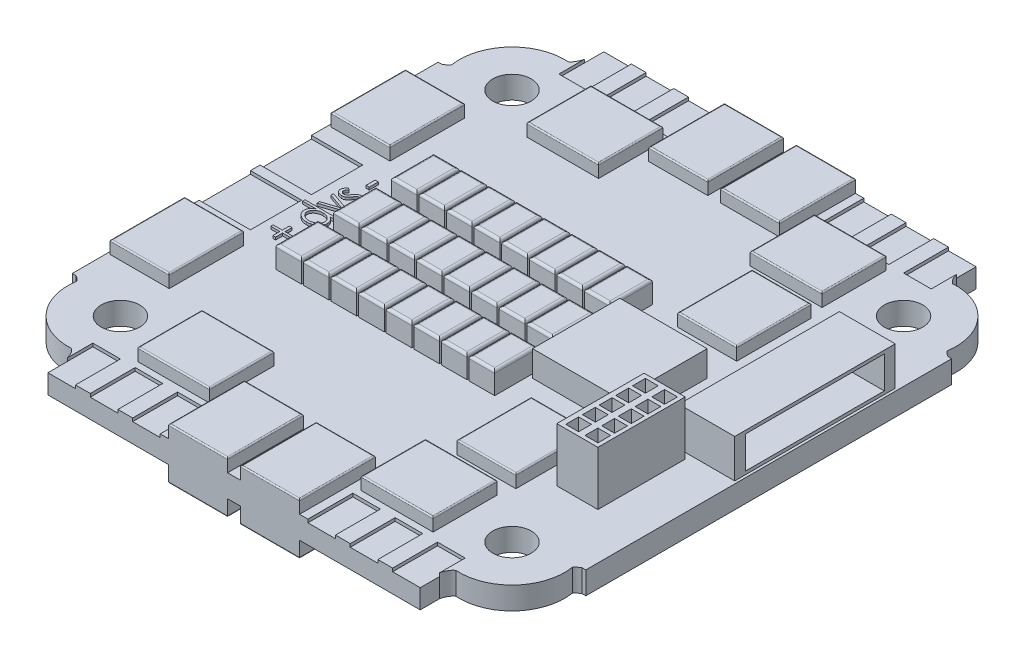
from build123d import *

# Parameters (mm, degrees)
IZIM1_W                          = 40
IZIM1_H                          = 43.3
Y_KSEKLIK_EKSTR_ZYON1_DEPTH      = 1.75
IZIM2_R                          = 1.5
KES_EKSTR_ZYON1_DEPTH            = 1.75
KES_EKSTR_ZYON4_DEPTH            = 1.75
KES_EKSTR_ZYON5_START            = 1.5
IZIM5_W                          = 2.147747616
IZIM5_H                          = 3.5
IZIM5_W_2                        = 2.15
KES_EKSTR_ZYON5_DEPTH            = 1
KES_EKSTR_ZYON7_START            = 1.5
IZIM6_W                          = 4
IZIM6_H                          = 4
KES_EKSTR_ZYON7_DEPTH            = 1
Y_KSEKLIK_EKSTR_ZYON2_DEPTH      = 2.75
Y_KSEKLIK_EKSTR_ZYON2_DEPTH_BACK = 1.25
IZIM7_W                          = 4.6
IZIM7_H                          = 5.8
IZIM9_W                          = 6.8
IZIM9_H                          = 6.8
Y_KSEKLIK_EKSTR_ZYON3_DEPTH      = 3.75
Y_KSEKLIK_EKSTR_ZYON4_DEPTH      = 2.75
Y_KSEKLIK_EKSTR_ZYON4_DEPTH_BACK = 1.25
IZIM10_W                         = 4.597884631
IZIM10_H                         = 5.9
IZIM10_W_2                       = 5.59620667
IZIM10_H_2                       = 5
IZIM11_W                         = 4
IZIM11_H                         = 4
KES_EKSTR_ZYON8_DEPTH            = 0.5
Y_KSEKLIK_EKSTR_ZYON5_START      = 1.75
IZIM12_W                         = 4.35
IZIM12_H                         = 12.5
Y_KSEKLIK_EKSTR_ZYON5_DEPTH      = 3
IZIM13_W                         = 10.8
IZIM13_H                         = 2.5
KES_EKSTR_ZYON9_DEPTH            = 13
Y_KSEKLIK_EKSTR_ZYON6_START      = 1.75
IZIM14_W                         = 3.2
IZIM14_H                         = 6.8
Y_KSEKLIK_EKSTR_ZYON6_DEPTH      = 4.2
IZIM15_W                         = 1
IZIM15_H                         = 1.002257236
KES_EKSTR_ZYON10_DEPTH           = 3
IZIM16_W                         = 2
IZIM16_H                         = 3.3
Y_KSEKLIK_EKSTR_ZYON7_DEPTH      = 3.45
RADYUS1_R                        = 0.2
RADYUS2_R                        = 0.1
IZIM17_W                         = 0.24423077
IZIM17_H                         = 0.702163462
Y_KSEKLIK_EKSTR_ZYON8_DEPTH      = 0.2
L_EK1_SCALE                      = 0.5


with BuildPart() as part:
    # Çizim1 → Yükseklik-Ekstrüzyon1 (new body)
    with BuildSketch(Plane(origin=(0, 0, 0), x_dir=(1, 0, 0), z_dir=(0, 1, 0))):
        Rectangle(IZIM1_W, IZIM1_H)
    extrude(amount=Y_KSEKLIK_EKSTR_ZYON1_DEPTH)

    # Çizim2 → Kes-Ekstrüzyon1 (cut)
    with BuildSketch(Plane(origin=(0, 0, 0), x_dir=(1, 0, 0), z_dir=(0, 1, 0))):
        with Locations(Location((-15.25, 15.25, 0), (0, 0, 270))):
            Circle(IZIM2_R)
        with Locations(Location((15.25, 15.25, 0), (0, 0, 270))):
            Circle(IZIM2_R)
        with Locations(Location((15.25, -15.25, 0), (0, 0, 270))):
            Circle(IZIM2_R)
        with Locations(Location((-15.25, -15.25, 0), (0, 0, 270))):
            Circle(IZIM2_R)
    extrude(amount=KES_EKSTR_ZYON1_DEPTH, mode=Mode.SUBTRACT)

    # Çizim3 → Kes-Ekstrüzyon4 (cut)
    with BuildSketch(Plane(origin=(0, 0, 0), x_dir=(1, 0, 0), z_dir=(0, 1, 0))):
        with BuildLine():
            Line((-19.717750654, 14.25), (-20, 14.25))
            Line((-20, 14.25), (-20, 21.65))
            Line((-20, 21.65), (-14.5, 21.65))
            Line((-14.5, 21.65), (-14.5, 20.13782588))
            add(Edge.make_bspline(
                [(-14.971291716, 19.340516067), (-14.753664146, 19.481272878), (-14.571354318, 19.808969024), (-14.5, 20.13782588)],
                knots=[0, 0, 0, 0, 1, 1, 1, 1], degree=3))
            ThreePointArc((-14.971291716, 19.340516067), (-18.280627176, 18.01139438), (-19.29702263, 14.593031333))
            add(Edge.make_bspline(
                [(-19.29702263, 14.593031333), (-19.433883097, 14.398452939), (-19.717750654, 14.25)],
                knots=[0, 0, 0, 1, 1, 1], degree=2))
        make_face()
        with BuildLine():
            Line((20, 21.65), (14.5, 21.65))
            Line((14.5, 21.65), (14.5, 20.13782588))
            add(Edge.make_bspline(
                [(14.971291716, 19.340516067), (14.753664146, 19.481272878), (14.571354318, 19.808969024), (14.5, 20.13782588)],
                knots=[0, 0, 0, 0, 1, 1, 1, 1], degree=3))
            ThreePointArc((14.971291716, 19.340516067), (18.280627176, 18.01139438), (19.29702263, 14.593031333))
            add(Edge.make_bspline(
                [(19.29702263, 14.593031333), (19.433883097, 14.398452939), (19.717750654, 14.25)],
                knots=[0, 0, 0, 1, 1, 1], degree=2))
            Line((19.717750654, 14.25), (20, 14.25))
            Line((20, 14.25), (20, 21.65))
        make_face()
        with BuildLine():
            Line((19.717750654, -14.25), (20, -14.25))
            Line((20, -14.25), (20, -21.65))
            Line((20, -21.65), (14.5, -21.65))
            Line((14.5, -21.65), (14.5, -20.13782588))
            add(Edge.make_bspline(
                [(14.971291716, -19.340516067), (14.753664146, -19.481272878), (14.571354318, -19.808969024), (14.5, -20.13782588)],
                knots=[0, 0, 0, 0, 1, 1, 1, 1], degree=3))
            ThreePointArc((14.971291716, -19.340516067), (18.280627176, -18.01139438), (19.29702263, -14.593031333))
            add(Edge.make_bspline(
                [(19.29702263, -14.593031333), (19.433883097, -14.398452939), (19.717750654, -14.25)],
                knots=[0, 0, 0, 1, 1, 1], degree=2))
        make_face()
        with BuildLine():
            Line((-20, -21.65), (-14.5, -21.65))
            Line((-14.5, -21.65), (-14.5, -20.13782588))
            add(Edge.make_bspline(
                [(-14.971291716, -19.340516067), (-14.753664146, -19.481272878), (-14.571354318, -19.808969024), (-14.5, -20.13782588)],
                knots=[0, 0, 0, 0, 1, 1, 1, 1], degree=3))
            ThreePointArc((-14.971291716, -19.340516067), (-18.280627176, -18.01139438), (-19.29702263, -14.593031333))
            add(Edge.make_bspline(
                [(-19.29702263, -14.593031333), (-19.433883097, -14.398452939), (-19.717750654, -14.25)],
                knots=[0, 0, 0, 1, 1, 1], degree=2))
            Line((-19.717750654, -14.25), (-20, -14.25))
            Line((-20, -14.25), (-20, -21.65))
        make_face()
    extrude(amount=KES_EKSTR_ZYON4_DEPTH, mode=Mode.SUBTRACT)

    # Çizim5 → Kes-Ekstrüzyon5 (cut)
    with BuildSketch(Plane(origin=(0, 0, 0), x_dir=(1, 0, 0), z_dir=(0, 1, 0)).offset(KES_EKSTR_ZYON5_START)):
        with Locations((-13.426126192, 19.9)):
            Rectangle(IZIM5_W, IZIM5_H)
        with Locations((-6.823873808, 19.9)):
            Rectangle(IZIM5_W, IZIM5_H)
        with Locations((-10.125, 19.9)):
            Rectangle(IZIM5_W_2, IZIM5_H)
        with Locations((10.125, 19.9)):
            Rectangle(IZIM5_W_2, IZIM5_H)
        with Locations((6.823873808, 19.9)):
            Rectangle(IZIM5_W, IZIM5_H)
        with Locations((13.426126192, 19.9)):
            Rectangle(IZIM5_W, IZIM5_H)
        with Locations((13.426126192, -19.9)):
            Rectangle(IZIM5_W, IZIM5_H)
        with Locations((6.823873808, -19.9)):
            Rectangle(IZIM5_W, IZIM5_H)
        with Locations((10.125, -19.9)):
            Rectangle(IZIM5_W_2, IZIM5_H)
        with Locations((-10.125, -19.9)):
            Rectangle(IZIM5_W_2, IZIM5_H)
        with Locations((-6.823873808, -19.9)):
            Rectangle(IZIM5_W, IZIM5_H)
        with Locations((-13.426126192, -19.9)):
            Rectangle(IZIM5_W, IZIM5_H)
    extrude(amount=KES_EKSTR_ZYON5_DEPTH, mode=Mode.SUBTRACT)

    # Çizim6 → Kes-Ekstrüzyon7 (cut)
    with BuildSketch(Plane(origin=(0, 0, 0), x_dir=(1, 0, 0), z_dir=(0, 1, 0)).offset(KES_EKSTR_ZYON7_START)):
        with Locations((-18, -2.375)):
            Rectangle(IZIM6_W, IZIM6_H)
        with Locations((-18, 2.375)):
            Rectangle(IZIM6_W, IZIM6_H)
    extrude(amount=KES_EKSTR_ZYON7_DEPTH, mode=Mode.SUBTRACT)

    # Çizim7 → Yükseklik-Ekstrüzyon2 (add, two sides: drawn at the far end of the back side and taken through both)
    with BuildSketch(Plane(origin=(0, 0, 0), x_dir=(1, 0, 0), z_dir=(0, 1, 0)).offset(-Y_KSEKLIK_EKSTR_ZYON2_DEPTH_BACK)):
        with Locations((-17.5, -8.6)):
            Rectangle(IZIM7_W, IZIM7_H)
        with Locations((-17.5, 8.6)):
            Rectangle(IZIM7_W, IZIM7_H)
        with Locations((9.5, -8.6)):
            Rectangle(IZIM7_W, IZIM7_H)
        with Locations((9.5, 8.6)):
            Rectangle(IZIM7_W, IZIM7_H)
    extrude(amount=Y_KSEKLIK_EKSTR_ZYON2_DEPTH + Y_KSEKLIK_EKSTR_ZYON2_DEPTH_BACK)

    # Çizim9 → Yükseklik-Ekstrüzyon3 (add)
    with BuildSketch(Plane(origin=(0, 0, 0), x_dir=(1, 0, 0), z_dir=(0, 1, 0))):
        with Locations((8.4, 0)):
            Rectangle(IZIM9_W, IZIM9_H)
    extrude(amount=Y_KSEKLIK_EKSTR_ZYON3_DEPTH)

    # Çizim10 → Yükseklik-Ekstrüzyon4 (add, two sides: drawn at the far end of the back side and taken through both)
    with BuildSketch(Plane(origin=(0, 0, 0), x_dir=(1, 0, 0), z_dir=(0, 1, 0)).offset(-Y_KSEKLIK_EKSTR_ZYON4_DEPTH_BACK)):
        with Locations((-2.801057685, 18.7)):
            Rectangle(IZIM10_W, IZIM10_H)
        with Locations((2.801057685, 18.7)):
            Rectangle(IZIM10_W, IZIM10_H)
        with Locations((8.701896665, 15.15)):
            Rectangle(IZIM10_W_2, IZIM10_H_2)
        with Locations((-8.701896665, 15.15)):
            Rectangle(IZIM10_W_2, IZIM10_H_2)
        with Locations((8.701896665, -15.15)):
            Rectangle(IZIM10_W_2, IZIM10_H_2)
        with Locations((-8.701896665, -15.15)):
            Rectangle(IZIM10_W_2, IZIM10_H_2)
        with Locations((-2.801057685, -18.7)):
            Rectangle(IZIM10_W, IZIM10_H)
        with Locations((2.801057685, -18.7)):
            Rectangle(IZIM10_W, IZIM10_H)
    extrude(amount=Y_KSEKLIK_EKSTR_ZYON4_DEPTH + Y_KSEKLIK_EKSTR_ZYON4_DEPTH_BACK)

    # Çizim11 → Kes-Ekstrüzyon8 (cut)
    with BuildSketch(Plane(origin=(0, 0, 0), x_dir=(1, 0, 0), z_dir=(0, 1, 0))):
        with Locations((-18.003680678, -2.654708619)):
            Rectangle(IZIM11_W, IZIM11_H)
        with Locations((-18.003680678, 2.095291381)):
            Rectangle(IZIM11_W, IZIM11_H)
    extrude(amount=KES_EKSTR_ZYON8_DEPTH, mode=Mode.SUBTRACT)

    # Çizim12 → Yükseklik-Ekstrüzyon5 (add)
    with BuildSketch(Plane(origin=(0, 0, 0), x_dir=(1, 0, 0), z_dir=(0, 1, 0)).offset(Y_KSEKLIK_EKSTR_ZYON5_START)):
        with Locations((17.625, 3.8)):
            Rectangle(IZIM12_W, IZIM12_H)
    extrude(amount=Y_KSEKLIK_EKSTR_ZYON5_DEPTH)

    # Çizim13 → Kes-Ekstrüzyon9 (cut)
    with BuildSketch(Plane(origin=(29.8, 0, 0), x_dir=(0, 0, -1), z_dir=(1, 0, 0))):
        with Locations((3.8, 3.25)):
            Rectangle(IZIM13_W, IZIM13_H)
    extrude(amount=-KES_EKSTR_ZYON9_DEPTH, mode=Mode.SUBTRACT)

    # Çizim14 → Yükseklik-Ekstrüzyon6 (add)
    with BuildSketch(Plane(origin=(0, 0, 0), x_dir=(1, 0, 0), z_dir=(0, 1, 0)).offset(Y_KSEKLIK_EKSTR_ZYON6_START)):
        with Locations((14.8, -6.310712731)):
            Rectangle(IZIM14_W, IZIM14_H)
    extrude(amount=Y_KSEKLIK_EKSTR_ZYON6_DEPTH)

    # Çizim15 → Kes-Ekstrüzyon10 (cut)
    with BuildSketch(Plane(origin=(0, 5.95, 0), x_dir=(1, 0, 0), z_dir=(0, 1, 0))):
        with Locations((14.1, -3.711841349)):
            Rectangle(IZIM15_W, IZIM15_H)
        with Locations((15.6, -3.711841349)):
            Rectangle(IZIM15_W, IZIM15_H)
        with Locations((14.1, -5.011841349)):
            Rectangle(IZIM15_W, IZIM15_H)
        with Locations((14.1, -6.311841349)):
            Rectangle(IZIM15_W, IZIM15_H)
        with Locations((14.1, -7.611841349)):
            Rectangle(IZIM15_W, IZIM15_H)
        with Locations((14.1, -8.911841349)):
            Rectangle(IZIM15_W, IZIM15_H)
        with Locations((15.6, -5.011841349)):
            Rectangle(IZIM15_W, IZIM15_H)
        with Locations((15.6, -6.311841349)):
            Rectangle(IZIM15_W, IZIM15_H)
        with Locations((15.6, -7.611841349)):
            Rectangle(IZIM15_W, IZIM15_H)
        with Locations((15.6, -8.911841349)):
            Rectangle(IZIM15_W, IZIM15_H)
    extrude(amount=-KES_EKSTR_ZYON10_DEPTH, mode=Mode.SUBTRACT)

    # Çizim16 → Yükseklik-Ekstrüzyon7 (add)
    with BuildSketch(Plane(origin=(0, 0, 0), x_dir=(1, 0, 0), z_dir=(0, 1, 0))):
        with Locations((1.55, 4.6)):
            Rectangle(IZIM16_W, IZIM16_H)
        with Locations((3.7, 4.6)):
            Rectangle(IZIM16_W, IZIM16_H)
        with Locations((-0.6, 4.6)):
            Rectangle(IZIM16_W, IZIM16_H)
        with Locations((-2.75, 4.6)):
            Rectangle(IZIM16_W, IZIM16_H)
        with Locations((-4.9, 4.6)):
            Rectangle(IZIM16_W, IZIM16_H)
        with Locations((-7.05, 4.6)):
            Rectangle(IZIM16_W, IZIM16_H)
        with Locations((-9.2, 4.6)):
            Rectangle(IZIM16_W, IZIM16_H)
        with Locations((-11.35, 4.6)):
            Rectangle(IZIM16_W, IZIM16_H)
        with Locations((1.55, 0.1)):
            Rectangle(IZIM16_W, IZIM16_H)
        with Locations((-0.6, 0.1)):
            Rectangle(IZIM16_W, IZIM16_H)
        with Locations((-2.75, 0.1)):
            Rectangle(IZIM16_W, IZIM16_H)
        with Locations((-4.9, 0.1)):
            Rectangle(IZIM16_W, IZIM16_H)
        with Locations((-7.05, 0.1)):
            Rectangle(IZIM16_W, IZIM16_H)
        with Locations((-9.2, 0.1)):
            Rectangle(IZIM16_W, IZIM16_H)
        with Locations((-11.35, 0.1)):
            Rectangle(IZIM16_W, IZIM16_H)
        with Locations((1.55, -4.4)):
            Rectangle(IZIM16_W, IZIM16_H)
        with Locations((-0.6, -4.4)):
            Rectangle(IZIM16_W, IZIM16_H)
        with Locations((-2.75, -4.4)):
            Rectangle(IZIM16_W, IZIM16_H)
        with Locations((-4.9, -4.4)):
            Rectangle(IZIM16_W, IZIM16_H)
        with Locations((-7.05, -4.4)):
            Rectangle(IZIM16_W, IZIM16_H)
        with Locations((-9.2, -4.4)):
            Rectangle(IZIM16_W, IZIM16_H)
        with Locations((-11.35, -4.4)):
            Rectangle(IZIM16_W, IZIM16_H)
        with Locations((3.7, 0.1)):
            Rectangle(IZIM16_W, IZIM16_H)
        with Locations((3.7, -4.4)):
            Rectangle(IZIM16_W, IZIM16_H)
    extrude(amount=Y_KSEKLIK_EKSTR_ZYON7_DEPTH)

    # Radyus1
    radyus1_edges = [part.edges().sort_by_distance(p)[0] for p in [
        (0.4, 3.45, -0.1),
        (-0.6, 3.45, -1.75),
        (-1.6, 3.45, -0.1),
        (-0.6, 3.45, 1.55),
        (-1.75, 3.45, -0.1),
        (-2.75, 3.45, -1.75),
        (-3.75, 3.45, -0.1),
        (-2.75, 3.45, 1.55),
        (-3.9, 3.45, -0.1),
        (-4.9, 3.45, -1.75),
        (-5.9, 3.45, -0.1),
        (-4.9, 3.45, 1.55),
        (-6.05, 3.45, -0.1),
        (-7.05, 3.45, -1.75),
        (-8.05, 3.45, -0.1),
        (-7.05, 3.45, 1.55),
        (-8.2, 3.45, -0.1),
        (-9.2, 3.45, -1.75),
        (-10.2, 3.45, -0.1),
        (-9.2, 3.45, 1.55),
        (-10.35, 3.45, -0.1),
        (-11.35, 3.45, -1.75),
        (-12.35, 3.45, -0.1),
        (-11.35, 3.45, 1.55),
        (2.55, 3.45, 4.4),
        (1.55, 3.45, 2.75),
        (0.55, 3.45, 4.4),
        (1.55, 3.45, 6.05),
        (0.4, 3.45, 4.4),
        (-0.6, 3.45, 2.75),
        (-1.6, 3.45, 4.4),
        (-0.6, 3.45, 6.05),
        (-1.75, 3.45, 4.4),
        (-2.75, 3.45, 2.75),
        (-3.75, 3.45, 4.4),
        (-2.75, 3.45, 6.05),
        (-3.9, 3.45, 4.4),
        (-4.9, 3.45, 2.75),
        (-5.9, 3.45, 4.4),
        (-4.9, 3.45, 6.05),
        (-6.05, 3.45, 4.4),
        (-7.05, 3.45, 2.75),
        (-8.05, 3.45, 4.4),
        (-7.05, 3.45, 6.05),
        (-8.2, 3.45, 4.4),
        (-9.2, 3.45, 2.75),
        (-10.2, 3.45, 4.4),
        (-9.2, 3.45, 6.05),
        (-10.35, 3.45, 4.4),
        (-11.35, 3.45, 2.75),
        (-12.35, 3.45, 4.4),
        (-11.35, 3.45, 6.05),
        (4.7, 3.45, -0.1),
        (3.7, 3.45, -1.75),
        (2.7, 3.45, -0.1),
        (3.7, 3.45, 1.55),
        (4.7, 3.45, 4.4),
        (3.7, 3.45, 2.75),
        (2.7, 3.45, 4.4),
        (3.7, 3.45, 6.05),
        (4.7, 3.45, -4.6),
        (3.7, 3.45, -6.25),
        (2.7, 3.45, -4.6),
        (3.7, 3.45, -2.95),
        (2.55, 3.45, -4.6),
        (1.55, 3.45, -6.25),
        (0.55, 3.45, -4.6),
        (1.55, 3.45, -2.95),
        (0.4, 3.45, -4.6),
        (-0.6, 3.45, -6.25),
        (-1.6, 3.45, -4.6),
        (-0.6, 3.45, -2.95),
        (-1.75, 3.45, -4.6),
        (-2.75, 3.45, -6.25),
        (-3.75, 3.45, -4.6),
        (-2.75, 3.45, -2.95),
        (-3.9, 3.45, -4.6),
        (-4.9, 3.45, -6.25),
        (-5.9, 3.45, -4.6),
        (-4.9, 3.45, -2.95),
        (-6.05, 3.45, -4.6),
        (-7.05, 3.45, -6.25),
        (-8.05, 3.45, -4.6),
        (-7.05, 3.45, -2.95),
        (-8.2, 3.45, -4.6),
        (-9.2, 3.45, -6.25),
        (-10.2, 3.45, -4.6),
        (-9.2, 3.45, -2.95),
        (-10.35, 3.45, -4.6),
        (-11.35, 3.45, -6.25),
        (-12.35, 3.45, -4.6),
        (-11.35, 3.45, -2.95),
        (2.55, 3.45, -0.1),
        (1.55, 3.45, -1.75),
        (0.55, 3.45, -0.1),
        (1.55, 3.45, 1.55),
    ]]
    fillet(radyus1_edges, radius=RADYUS1_R)

    # Radyus2
    radyus2_edges = [part.edges().sort_by_distance(p)[0] for p in [
        (-15.2, -1.25, 8.6),
        (-17.5, -1.25, 11.5),
        (-19.8, -1.25, 8.6),
        (-17.5, -1.25, 5.7),
        (-15.2, 2.75, 8.6),
        (-17.5, 2.75, 5.7),
        (-19.8, 2.75, 8.6),
        (-17.5, 2.75, 11.5),
        (-15.2, -1.25, -8.6),
        (-17.5, -1.25, -5.7),
        (-19.8, -1.25, -8.6),
        (-17.5, -1.25, -11.5),
        (-15.2, 2.75, -8.6),
        (-17.5, 2.75, -11.5),
        (-19.8, 2.75, -8.6),
        (-17.5, 2.75, -5.7),
        (9.5, -1.25, 11.5),
        (7.2, -1.25, 8.6),
        (9.5, -1.25, 5.7),
        (11.8, -1.25, 8.6),
        (9.5, 2.75, 11.5),
        (11.8, 2.75, 8.6),
        (9.5, 2.75, 5.7),
        (7.2, 2.75, 8.6),
        (9.5, -1.25, -11.5),
        (11.8, -1.25, -8.6),
        (9.5, -1.25, -5.7),
        (7.2, -1.25, -8.6),
        (9.5, 2.75, -11.5),
        (7.2, 2.75, -8.6),
        (9.5, 2.75, -5.7),
        (11.8, 2.75, -8.6),
        (-5.1, 2.75, -18.7),
        (-2.801057684, 2.75, -15.75),
        (-0.502115369, 2.75, -18.7),
        (-2.801057684, 2.75, -21.65),
        (2.801057684, 2.75, -15.75),
        (5.1, 2.75, -18.7),
        (2.801057684, 2.75, -21.65),
        (0.502115369, 2.75, -18.7),
        (-11.5, -1.25, -15.15),
        (-8.701896665, -1.25, -17.65),
        (-5.90379333, -1.25, -15.15),
        (-8.701896665, -1.25, -12.65),
        (-11.5, 2.75, -15.15),
        (-8.701896665, 2.75, -12.65),
        (-5.90379333, 2.75, -15.15),
        (-8.701896665, 2.75, -17.65),
        (8.701896665, -1.25, -12.65),
        (5.90379333, -1.25, -15.15),
        (8.701896665, -1.25, -17.65),
        (11.5, -1.25, -15.15),
        (8.701896665, 2.75, -12.65),
        (11.5, 2.75, -15.15),
        (8.701896665, 2.75, -17.65),
        (5.90379333, 2.75, -15.15),
        (11.5, -1.25, 15.15),
        (8.701896665, -1.25, 17.65),
        (5.90379333, -1.25, 15.15),
        (8.701896665, -1.25, 12.65),
        (11.5, 2.75, 15.15),
        (8.701896665, 2.75, 12.65),
        (5.90379333, 2.75, 15.15),
        (8.701896665, 2.75, 17.65),
        (-11.5, -1.25, 15.15),
        (-8.701896665, -1.25, 12.65),
        (-5.90379333, -1.25, 15.15),
        (-8.701896665, -1.25, 17.65),
        (-11.5, 2.75, 15.15),
        (-8.701896665, 2.75, 17.65),
        (-5.90379333, 2.75, 15.15),
        (-8.701896665, 2.75, 12.65),
        (2.801057684, -1.25, 21.65),
        (0.502115369, -1.25, 18.7),
        (2.801057684, -1.25, 15.75),
        (5.1, -1.25, 18.7),
        (2.801057684, 2.75, 21.65),
        (5.1, 2.75, 18.7),
        (2.801057684, 2.75, 15.75),
        (0.502115369, 2.75, 18.7),
        (-2.801057684, -1.25, 15.75),
        (-0.502115369, -1.25, 18.7),
        (-2.801057684, -1.25, 21.65),
        (-5.1, -1.25, 18.7),
        (-2.801057684, 2.75, 15.75),
        (-5.1, 2.75, 18.7),
        (-2.801057684, 2.75, 21.65),
        (-0.502115369, 2.75, 18.7),
    ]]
    fillet(radyus2_edges, radius=RADYUS2_R)

    # Çizim17 → Yükseklik-Ekstrüzyon8 (add)
    # profile 1 of 5: a face of its own
    with BuildSketch(Plane(origin=(0, 1.75, 0), x_dir=(1, 0, 0), z_dir=(0, 1, 0))):
        Polygon((-14.545757748, -3.534220415), (-15.247921209, -3.534220415), (-15.247921209, -3.351047338), (-14.545757748, -3.351047338), (-14.545757748, -2.801528107), (-14.332055825, -2.801528107), (-14.332055825, -3.351047338), (-13.629892363, -3.351047338), (-13.629892363, -3.534220415), (-14.332055825, -3.534220415), (-14.332055825, -4.083739645), (-14.545757748, -4.083739645), align=None)
    # profile 2 of 5: a face of its own
    with BuildSketch(Plane(origin=(0, 1.75, 0), x_dir=(1, 0, 0), z_dir=(0, 1, 0))):
        with BuildLine():
            Line((-15.705853902, -0.420278107), (-13.263546209, -0.420278107))
            Line((-13.263546209, -0.420278107), (-13.263546209, -0.603451184))
            Line((-13.263546209, -0.603451184), (-13.564541552, -0.603451184))
            add(Edge.make_bspline(
                [(-13.564541552, -0.603451184), (-13.53746896, -0.622039409), (-13.485206737, -0.657923005), (-13.415276505, -0.717920722), (-13.357973194, -0.782577607), (-13.311447669, -0.850219237), (-13.276384877, -0.92156596), (-13.251512393, -0.995845728), (-13.235399772, -1.073252432), (-13.233818078, -1.126177633), (-13.233017363, -1.152970415)],
                knots=[0, 0, 0, 0, 1.172747878, 2.263928442, 3.281922024, 4.25087268, 5.188273431, 6.111575823, 7.044006704, 8, 8, 8, 8], degree=3))
            add(Edge.make_bspline(
                [(-13.233017363, -1.152970415), (-13.233851804, -1.176876084), (-13.235498799, -1.224060412), (-13.248319133, -1.293283332), (-13.268974441, -1.359738997), (-13.297844754, -1.423728702), (-13.335207201, -1.484904231), (-13.381215798, -1.542968139), (-13.435037905, -1.598587724), (-13.496490458, -1.650815016), (-13.563766709, -1.698552984), (-13.635064437, -1.740903658), (-13.710308742, -1.776321186), (-13.789292543, -1.804823982), (-13.871611769, -1.827271661), (-13.957388291, -1.843571182), (-14.046742426, -1.853149529), (-14.107518572, -1.854465472), (-14.138388457, -1.855133876)],
                knots=[0, 0, 0, 0, 0.903163779, 1.78263887, 2.651389892, 3.528335299, 4.429236434, 5.353843816, 6.32297284, 7.350379706, 8.397704944, 9.43776181, 10.480939894, 11.536168289, 12.607837322, 13.702913536, 14.833246301, 16, 16, 16, 16], degree=3))
            add(Edge.make_bspline(
                [(-14.138388457, -1.855133876), (-14.16862298, -1.854462767), (-14.228289742, -1.853138356), (-14.316052745, -1.84355125), (-14.400622454, -1.827316159), (-14.481653373, -1.804398577), (-14.559507991, -1.775318543), (-14.633660184, -1.739115665), (-14.705001104, -1.697348132), (-14.771711501, -1.648855802), (-14.83273915, -1.596068044), (-14.886497813, -1.540095364), (-14.932478433, -1.481777235), (-14.969345382, -1.420032406), (-14.998831008, -1.356038427), (-15.019511317, -1.289019636), (-15.0315588, -1.219392803), (-15.033326256, -1.172097059), (-15.034219286, -1.148200282)],
                knots=[0, 0, 0, 0, 1.147764703, 2.265073058, 3.347188514, 4.413563271, 5.458552615, 6.498034846, 7.542675396, 8.593229709, 9.624528646, 10.602280619, 11.535718512, 12.43746343, 13.326263971, 14.204609005, 15.092855845, 16, 16, 16, 16], degree=3))
            add(Edge.make_bspline(
                [(-15.034219286, -1.148200282), (-15.03315849, -1.120757521), (-15.031064667, -1.066590363), (-15.01317639, -0.987458727), (-14.984448014, -0.912314174), (-14.94366916, -0.841261231), (-14.891068499, -0.774827569), (-14.827191093, -0.712360964), (-14.752192023, -0.653963462), (-14.695944499, -0.62064467), (-14.666919106, -0.603451184)],
                knots=[0, 0, 0, 0, 0.951594992, 1.878280231, 2.800748451, 3.735175227, 4.710076232, 5.732587844, 6.829948001, 8, 8, 8, 8], degree=3))
            Line((-14.666919106, -0.603451184), (-15.705853902, -0.603451184))
            Line((-15.705853902, -0.603451184), (-15.705853902, -0.420278107))
        make_face()
        with BuildLine():
            add(Edge.make_bspline(
                [(-14.820517363, -1.137228978), (-14.819420258, -1.161023437), (-14.817249774, -1.208097783), (-14.799623284, -1.277242554), (-14.771320096, -1.34337394), (-14.73178181, -1.406213771), (-14.682054964, -1.464079491), (-14.623355784, -1.516871119), (-14.554690888, -1.561812428), (-14.479109207, -1.601284999), (-14.397338434, -1.632292486), (-14.312417071, -1.655431692), (-14.224844805, -1.669018012), (-14.165782893, -1.670974382), (-14.136003391, -1.671960799)],
                knots=[0, 0, 0, 0, 0.890056594, 1.76086514, 2.654499465, 3.574716069, 4.529255787, 5.503372661, 6.520644566, 7.593881512, 8.690822744, 9.788539383, 10.884963373, 12, 12, 12, 12], degree=3))
            add(Edge.make_bspline(
                [(-14.136003391, -1.671960799), (-14.106383807, -1.670964688), (-14.047482925, -1.668983843), (-13.960213701, -1.655487686), (-13.875117445, -1.632168295), (-13.793038322, -1.600687807), (-13.71623337, -1.561431133), (-13.646783803, -1.515881745), (-13.587240459, -1.462844067), (-13.536835274, -1.404592593), (-13.496604567, -1.342036865), (-13.468158298, -1.27609803), (-13.449932596, -1.208009264), (-13.447792757, -1.161509865), (-13.446719286, -1.138183005)],
                knots=[0, 0, 0, 0, 1.107208297, 2.201771173, 3.291886461, 4.400195165, 5.482177094, 6.510909783, 7.496205014, 8.452991324, 9.383017846, 10.264216512, 11.12922794, 12, 12, 12, 12], degree=3))
            add(Edge.make_bspline(
                [(-13.446719286, -1.138183005), (-13.447857026, -1.114713854), (-13.450130437, -1.067818208), (-13.467574577, -0.998420579), (-13.496607555, -0.931354073), (-13.536409411, -0.867162241), (-13.58521454, -0.807222349), (-13.642903693, -0.753971717), (-13.708719341, -0.708130713), (-13.782127021, -0.670339639), (-13.861868661, -0.640329223), (-13.946837461, -0.618978492), (-14.03668716, -0.605750756), (-14.098272569, -0.604229841), (-14.129802219, -0.603451184)],
                knots=[0, 0, 0, 0, 0.876430904, 1.751268901, 2.656380427, 3.598087967, 4.565158369, 5.536527855, 6.522331019, 7.553563889, 8.614202314, 9.699457988, 10.822200185, 12, 12, 12, 12], degree=3))
            add(Edge.make_bspline(
                [(-14.129802219, -0.603451184), (-14.15383177, -0.603886416), (-14.201046488, -0.604741587), (-14.270383846, -0.612153212), (-14.336863918, -0.623681794), (-14.400014899, -0.641286258), (-14.460590527, -0.662439066), (-14.517693317, -0.689409114), (-14.57220675, -0.720446515), (-14.622657226, -0.756481086), (-14.668834896, -0.795865133), (-14.709531274, -0.837652891), (-14.74389388, -0.881930175), (-14.771648544, -0.928646151), (-14.794103166, -0.977415029), (-14.808934522, -1.028920024), (-14.819228851, -1.082279942), (-14.820083668, -1.118733892), (-14.820517363, -1.137228978)],
                knots=[0, 0, 0, 0, 1.188172481, 2.334593263, 3.445282313, 4.521295281, 5.57350723, 6.614936672, 7.640145624, 8.672298908, 9.676294346, 10.638484653, 11.55241243, 12.441226742, 13.321194475, 14.199508958, 15.086512205, 16, 16, 16, 16], degree=3))
        make_face(mode=Mode.SUBTRACT)
    # profile 3 of 5: a face of its own
    with BuildSketch(Plane(origin=(0, 1.75, 0), x_dir=(1, 0, 0), z_dir=(0, 1, 0))):
        Polygon((-15.00369044, -0.176047338), (-15.00369044, 0.024298215), (-13.696197201, 0.453133101), (-15.00369044, 0.905818648), (-15.00369044, 1.106164201), (-12.62244044, 0.281885355), (-12.62244044, 0.081539802), (-13.399494977, 0.350098245), align=None)
    # profile 4 of 5: a face of its own
    with BuildSketch(Plane(origin=(0, 1.75, 0), x_dir=(1, 0, 0), z_dir=(0, 1, 0))):
        with BuildLine():
            Line((-14.786649424, 2.052558432), (-14.637344286, 1.939983311))
            add(Edge.make_bspline(
                [(-14.637344286, 1.939983311), (-14.651824071, 1.92890169), (-14.679626729, 1.907623852), (-14.716975331, 1.873666227), (-14.748596779, 1.839848447), (-14.774599261, 1.806398531), (-14.79527472, 1.773166291), (-14.809539041, 1.739692645), (-14.818781353, 1.7064205), (-14.819947171, 1.684200527), (-14.820517363, 1.673332921)],
                knots=[0, 0, 0, 0, 1.306439345, 2.508496321, 3.613260685, 4.620812336, 5.541400319, 6.409338993, 7.222020771, 8, 8, 8, 8], degree=3))
            add(Edge.make_bspline(
                [(-14.820517363, 1.673332921), (-14.819744591, 1.660018914), (-14.818204722, 1.63348868), (-14.804052937, 1.595563014), (-14.781375783, 1.560947389), (-14.750884869, 1.530356113), (-14.714608113, 1.50502285), (-14.674536139, 1.485996808), (-14.631273657, 1.474715892), (-14.601474804, 1.473254411), (-14.586303872, 1.472510355)],
                knots=[0, 0, 0, 0, 0.933863505, 1.860868679, 2.807176705, 3.827539879, 4.879540348, 5.905345823, 6.933587894, 8, 8, 8, 8], degree=3))
            add(Edge.make_bspline(
                [(-14.586303872, 1.472510355), (-14.572556441, 1.472940988), (-14.54519448, 1.473798092), (-14.50516477, 1.484491168), (-14.465345651, 1.498657934), (-14.440910713, 1.513549051), (-14.428412495, 1.521165703)],
                knots=[0, 0, 0, 0, 0.98233681, 1.955177088, 2.954094317, 4, 4, 4, 4], degree=3))
            add(Edge.make_bspline(
                [(-14.428412495, 1.521165703), (-14.414738646, 1.531296874), (-14.384499303, 1.553701678), (-14.34197313, 1.599803841), (-14.295393769, 1.657764996), (-14.265250869, 1.702334719), (-14.249055524, 1.726281388)],
                knots=[0, 0, 0, 0, 0.743872285, 1.645053101, 2.734720995, 4, 4, 4, 4], degree=3))
            add(Edge.make_bspline(
                [(-14.249055524, 1.726281388), (-14.238664348, 1.741617975), (-14.218514928, 1.77135699), (-14.187477549, 1.813480285), (-14.156554638, 1.85179728), (-14.125480446, 1.885848958), (-14.095663351, 1.916884582), (-14.0652048, 1.943125498), (-14.035468367, 1.966253399), (-14.014795209, 1.979102552), (-14.004824755, 1.985299567)],
                knots=[0, 0, 0, 0, 1.238690231, 2.401931283, 3.497917914, 4.529283228, 5.484150422, 6.373358913, 7.21548754, 8, 8, 8, 8], degree=3))
            add(Edge.make_bspline(
                [(-14.004824755, 1.985299567), (-13.984580107, 1.99578617), (-13.943847676, 2.016885319), (-13.877528777, 2.037197457), (-13.807853713, 2.050180435), (-13.760178689, 2.051753625), (-13.735789298, 2.052558432)],
                knots=[0, 0, 0, 0, 0.974368447, 1.960438955, 2.956609841, 4, 4, 4, 4], degree=3))
            add(Edge.make_bspline(
                [(-13.735789298, 2.052558432), (-13.718598254, 2.052216948), (-13.684754453, 2.051544674), (-13.635038543, 2.045487793), (-13.587268597, 2.036702094), (-13.541384832, 2.02372883), (-13.497752117, 2.006506697), (-13.456081587, 1.985967809), (-13.416360599, 1.961869047), (-13.379410503, 1.933951659), (-13.344825663, 1.90387423), (-13.315426189, 1.870645318), (-13.289654285, 1.836311673), (-13.269126281, 1.799638326), (-13.252654711, 1.761342985), (-13.24121518, 1.720942606), (-13.234453501, 1.678649475), (-13.23350138, 1.649824981), (-13.233017363, 1.635171863)],
                knots=[0, 0, 0, 0, 1.133783037, 2.232064898, 3.299912731, 4.336008522, 5.372422932, 6.390516929, 7.398070579, 8.432465411, 9.443072923, 10.416232299, 11.354147209, 12.270216781, 13.182132094, 14.09862206, 15.033422235, 16, 16, 16, 16], degree=3))
            add(Edge.make_bspline(
                [(-13.233017363, 1.635171863), (-13.23368412, 1.615387912), (-13.235008612, 1.576087699), (-13.247795134, 1.518099891), (-13.267210672, 1.4613576), (-13.295201816, 1.406841547), (-13.329054231, 1.35498544), (-13.370002805, 1.307818735), (-13.415925949, 1.264430712), (-13.450982718, 1.240398874), (-13.468661894, 1.228279585)],
                knots=[0, 0, 0, 0, 0.967740958, 1.922387744, 2.895285857, 3.898388969, 4.915781678, 5.921029111, 6.951572178, 8, 8, 8, 8], degree=3))
            Line((-13.468661894, 1.228279585), (-13.629892363, 1.338469639))
            add(Edge.make_bspline(
                [(-13.629892363, 1.338469639), (-13.615396384, 1.349370622), (-13.587490494, 1.370355864), (-13.550148054, 1.404363558), (-13.518355399, 1.438718084), (-13.492329395, 1.47367518), (-13.471816097, 1.509285342), (-13.457567738, 1.545631486), (-13.448370102, 1.582406298), (-13.447267502, 1.607135169), (-13.446719286, 1.619430427)],
                knots=[0, 0, 0, 0, 1.249338816, 2.405074618, 3.475318477, 4.470274505, 5.402622068, 6.297918227, 7.153720577, 8, 8, 8, 8], degree=3))
            add(Edge.make_bspline(
                [(-13.446719286, 1.619430427), (-13.447674982, 1.636261025), (-13.449558177, 1.669425651), (-13.466203927, 1.716694484), (-13.49279791, 1.760001719), (-13.529416024, 1.797626371), (-13.572331061, 1.829514726), (-13.620292722, 1.85292267), (-13.672399893, 1.866559479), (-13.70836113, 1.86843007), (-13.726726047, 1.869385355)],
                knots=[0, 0, 0, 0, 0.968458622, 1.908343873, 2.855453285, 3.880639528, 4.917253359, 5.926515418, 6.941099486, 8, 8, 8, 8], degree=3))
            add(Edge.make_bspline(
                [(-13.726726047, 1.869385355), (-13.741885173, 1.868913116), (-13.771537147, 1.867989394), (-13.81473588, 1.858387409), (-13.855591799, 1.843444822), (-13.880366464, 1.828608782), (-13.892726648, 1.821207019)],
                knots=[0, 0, 0, 0, 1.036227379, 2.026910152, 3.015617245, 4, 4, 4, 4], degree=3))
            add(Edge.make_bspline(
                [(-13.892726648, 1.821207019), (-13.898873841, 1.816721763), (-13.912209872, 1.806991221), (-13.931256527, 1.788499473), (-13.952487129, 1.767360686), (-13.973883654, 1.741372532), (-13.99711834, 1.712360772), (-14.020937788, 1.678997338), (-14.046276978, 1.642298257), (-14.063240712, 1.616291727), (-14.072083619, 1.602734964)],
                knots=[0, 0, 0, 0, 0.64198877, 1.392762971, 2.238016028, 3.171781159, 4.233111429, 5.37752381, 6.632947586, 8, 8, 8, 8], degree=3))
            add(Edge.make_bspline(
                [(-14.072083619, 1.602734964), (-14.091590189, 1.574345865), (-14.12834933, 1.520848048), (-14.188235771, 1.451344553), (-14.247043603, 1.395193882), (-14.289644167, 1.367950269), (-14.309636203, 1.355165102)],
                knots=[0, 0, 0, 0, 1.193761487, 2.249582949, 3.178546068, 4, 4, 4, 4], degree=3))
            add(Edge.make_bspline(
                [(-14.309636203, 1.355165102), (-14.329579905, 1.345028649), (-14.369776266, 1.324598713), (-14.435518721, 1.304584033), (-14.505181946, 1.291722089), (-14.55317042, 1.290144335), (-14.577717634, 1.289337278)],
                knots=[0, 0, 0, 0, 0.960950054, 1.936786705, 2.944618726, 4, 4, 4, 4], degree=3))
            add(Edge.make_bspline(
                [(-14.577717634, 1.289337278), (-14.593784975, 1.289780479), (-14.625194849, 1.290646889), (-14.671372658, 1.295183679), (-14.715278189, 1.304100114), (-14.757580162, 1.315244349), (-14.797651287, 1.330566032), (-14.835430478, 1.349456096), (-14.871622854, 1.370678476), (-14.90460526, 1.396150356), (-14.935187303, 1.423357895), (-14.961543746, 1.453280841), (-14.984270223, 1.484749378), (-15.002272509, 1.518419634), (-15.016879233, 1.553321572), (-15.026827504, 1.590213529), (-15.033280572, 1.628741734), (-15.033903807, 1.655179902), (-15.034219286, 1.668562789)],
                knots=[0, 0, 0, 0, 1.163801421, 2.275102988, 3.354452776, 4.404669307, 5.439627643, 6.454015416, 7.461058159, 8.47197681, 9.466435164, 10.420689067, 11.353587904, 12.270650064, 13.17936225, 14.087198709, 15.031748201, 16, 16, 16, 16], degree=3))
            add(Edge.make_bspline(
                [(-15.034219286, 1.668562789), (-15.033466906, 1.684529107), (-15.031943246, 1.716862846), (-15.019778143, 1.76529977), (-15.000071831, 1.813556841), (-14.972198033, 1.861655883), (-14.937190212, 1.909911916), (-14.894322321, 1.958058101), (-14.844058478, 2.006556513), (-14.806310926, 2.036803655), (-14.786649424, 2.052558432)],
                knots=[0, 0, 0, 0, 0.81018841, 1.640730093, 2.521060061, 3.450651814, 4.457088456, 5.544274266, 6.720890381, 8, 8, 8, 8], degree=3))
        make_face()
    # profile 5 of 5: a face of its own
    with BuildSketch(Plane(origin=(0, 1.75, 0), x_dir=(1, 0, 0), z_dir=(0, 1, 0))):
        with Locations((-14.179411594, 3.288976701)):
            Rectangle(IZIM17_W, IZIM17_H)
    extrude(amount=Y_KSEKLIK_EKSTR_ZYON8_DEPTH)


with BuildPart() as part_1:
    # Ölçek1: scaled about (0.375762131, 1.077103899, 0.010463149)
    add(part.part.scale(L_EK1_SCALE).moved(Location((0.187881065, 0.538551949, 0.005231574))))


solid = part_1.part
